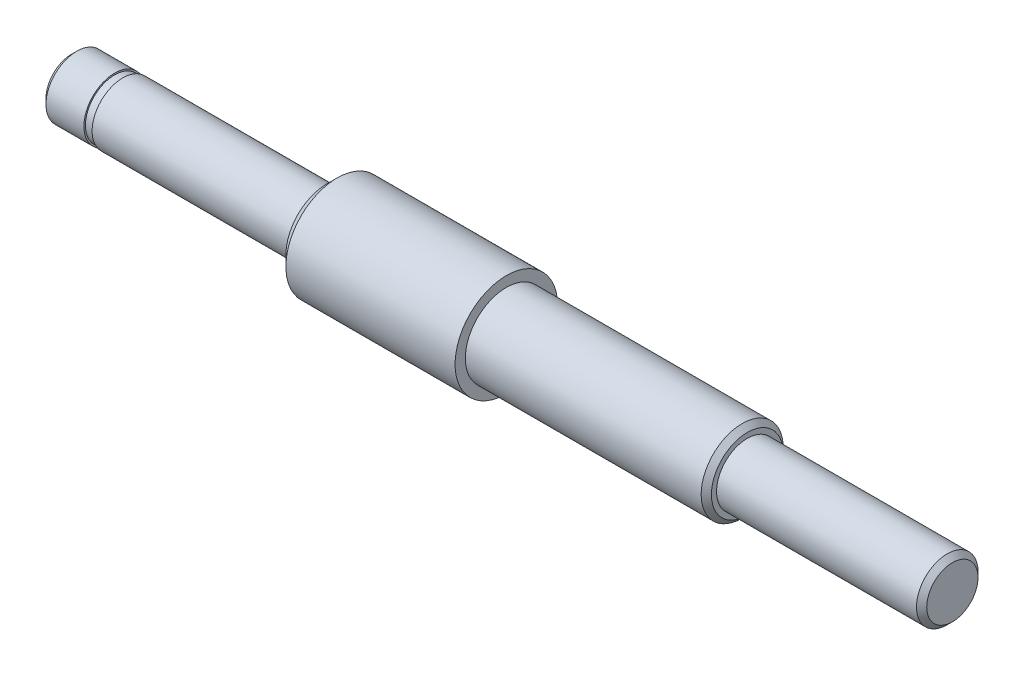
from build123d import *

# Parameters (mm, degrees)
CHAFL_N1_SIZE = 0.5
CHAFL_N2_SIZE = 1


with BuildPart() as part:
    # Croquis1 → Revolución1 (revolve)
    with BuildSketch(Plane(origin=(0, 0, 0), x_dir=(-1, 0, 0), z_dir=(0, 1, 0))):
        Polygon((-42.95, 0), (-42.95, 3), (-22.95, 3), (-22.95, 4), (0.55, 4), (0.55, 5), (18.05, 5), (18.05, 3), (37.95, 3), (37.95, 2.85), (38.75, 2.85), (38.75, 3), (42.95, 3), (42.95, 0), align=None)
    revolve(axis=Axis((42.95, 0, 0), (-1, 0, 0)))

    # Chaflán1
    chafl_n1_edges = [part.edges().sort_by_distance(p)[0] for p in [
        (-42.95, 0, -3),
        (42.95, 0, -3),
        (22.95, 0, -4),
    ]]
    chamfer(chafl_n1_edges, length=CHAFL_N1_SIZE)

    # Chaflán2
    chafl_n2_edges = [part.edges().sort_by_distance(p)[0] for p in [
        (-18.05, 0, -5),
    ]]
    chamfer(chafl_n2_edges, length=CHAFL_N2_SIZE)


solid = part.part
